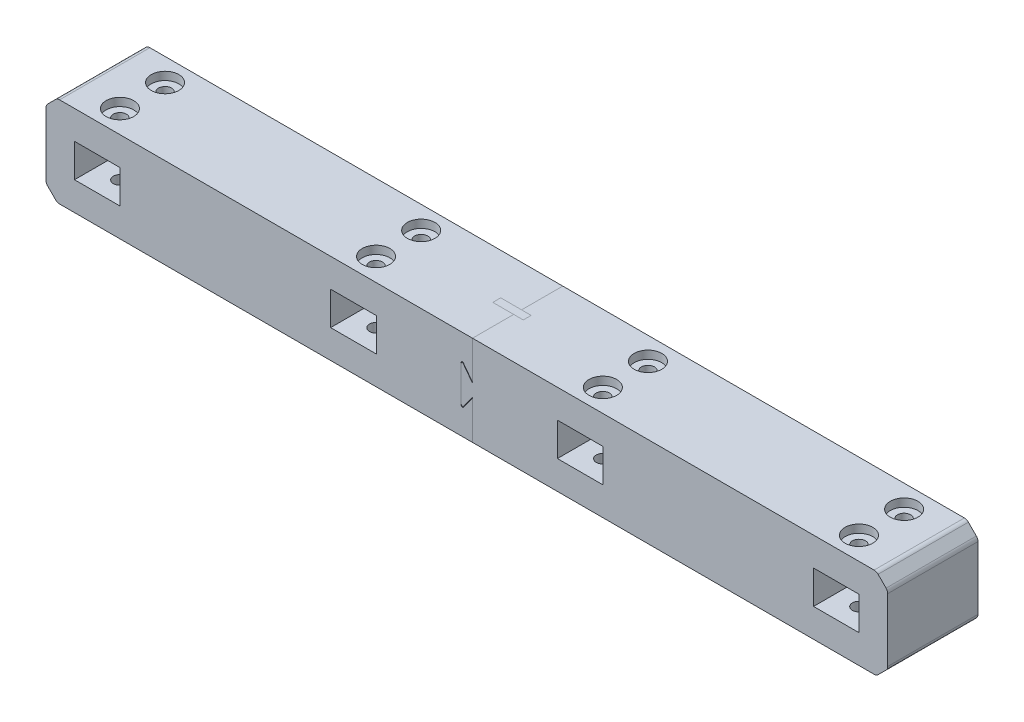
from build123d import *

# Parameters (mm, degrees)
SKETCH2_W                               = 373
SKETCH2_H                               = 40
BOSS_EXTRUDE1_DEPTH                     = 40
SKETCH3_W                               = 20.25
SKETCH3_H                               = 14.75
CUT_EXTRUDE1_DEPTH                      = 192.786991217
CHAMFER1_SIZE                           = 5
FILLET1_R                               = 2.5
CBORE_FOR_M5_HEX_HEAD_BOLT1_D           = 5.8
CBORE_FOR_M5_HEX_HEAD_BOLT1_CBORE_D     = 12.24
CBORE_FOR_M5_HEX_HEAD_BOLT1_CBORE_DEPTH = 3.58
LPATTERN1_COUNT                         = 2
LPATTERN1_PITCH                         = 113.5
MIRROR1_COPY_1_D                        = 5.8
MIRROR1_COPY_1_CBORE_D                  = 12.24
MIRROR1_COPY_1_CBORE_DEPTH              = 3.58
MIRROR2_COPY_1_D                        = 5.8
MIRROR2_COPY_1_CBORE_D                  = 12.24
MIRROR2_COPY_1_CBORE_DEPTH              = 3.58
MIRROR2_COPY_2_D                        = 5.8
MIRROR2_COPY_2_CBORE_D                  = 12.24
MIRROR2_COPY_2_CBORE_DEPTH              = 3.58
MIRROR2_COPY_3_D                        = 5.8
MIRROR2_COPY_3_CBORE_D                  = 12.24
MIRROR2_COPY_3_CBORE_DEPTH              = 3.58
SPLIT1_OUTLINE_W                        = 20.25
SPLIT1_OUTLINE_H                        = 14.75
SPLIT1_DEPTH                            = 40
SPLIT1_START                            = 18.25
SPLIT1_2_DEPTH                          = 3.5
SPLIT1_START_2                          = -20
SPLIT1_3_OUTLINE_W                      = 93.25
SPLIT1_3_OUTLINE_H                      = 40
SPLIT1_3_OUTLINE_W_2                    = 12.625
SPLIT1_3_DEPTH                          = 40
SPLIT1_4_OUTLINE_W                      = 5
SPLIT1_4_OUTLINE_H                      = 18.25
SPLIT1_4_OUTLINE_W_2                    = 20.25
SPLIT1_4_OUTLINE_H_2                    = 40
SPLIT1_4_OUTLINE_R                      = 2.9
SPLIT1_4_DEPTH                          = 12.625
SPLIT1_START_3                          = 7.375
SPLIT1_5_OUTLINE_W                      = 5
SPLIT1_5_OUTLINE_H                      = 18.25
SPLIT1_5_OUTLINE_W_2                    = 20.25
SPLIT1_5_OUTLINE_H_2                    = 40
SPLIT1_5_OUTLINE_R                      = 6.12
SPLIT1_5_DEPTH                          = 12.625
SPLIT1_6_OUTLINE_R                      = 6.12
SPLIT1_6_OUTLINE_R_2                    = 2.9
SPLIT1_6_DEPTH                          = 9.045
SPLIT1_START_4                          = -7.375
SPLIT1_7_OUTLINE_W                      = 5
SPLIT1_7_OUTLINE_H                      = 18.25
SPLIT1_7_DEPTH                          = 4.625
SPLIT1_START_5                          = 2.75
SPLIT1_8_OUTLINE_W                      = 5
SPLIT1_8_OUTLINE_H                      = 18.25
SPLIT1_8_DEPTH                          = 4.625
SPLIT1_START_6                          = -1
SPLIT1_9_DEPTH                          = 42
SPLIT1_10_DEPTH                         = 3.5
SPLIT1_11_DEPTH                         = 3.5
CUT_EXTRUDE3_DEPTH                      = 192.786991217
FILLET2_R                               = 0.5
FILLET3_R                               = 0.5


with BuildPart() as part:
    # Sketch2 → Boss-Extrude1 (new body)
    with BuildSketch(Plane.XY):
        Rectangle(SKETCH2_W, SKETCH2_H)
    extrude(amount=BOSS_EXTRUDE1_DEPTH)

    # Sketch3 → Cut-Extrude1 (cut, through all)
    with BuildSketch(Plane.XY.offset(40)):
        with Locations((-163.75, 0)):
            Rectangle(SKETCH3_W, SKETCH3_H)
        with Locations((-50.25, 0)):
            Rectangle(SKETCH3_W, SKETCH3_H)
        with Locations((50.25, 0)):
            Rectangle(SKETCH3_W, SKETCH3_H)
        with Locations((163.75, 0)):
            Rectangle(SKETCH3_W, SKETCH3_H)
    extrude(amount=-CUT_EXTRUDE1_DEPTH, mode=Mode.SUBTRACT)

    # Chamfer1
    chamfer1_edges = [part.edges().sort_by_distance(p)[0] for p in [
        (186.5, -20, 20),
        (-186.5, -20, 20),
        (-186.5, 20, 20),
        (186.5, 20, 20),
    ]]
    chamfer(chamfer1_edges, length=CHAMFER1_SIZE)

    # Fillet1
    fillet1_edges = [part.edges().sort_by_distance(p)[0] for p in [
        (-181.5, 20, 20),
        (181.5, 20, 20),
        (186.5, -15, 20),
        (186.5, 15, 20),
        (-181.5, -20, 20),
        (181.5, -20, 20),
        (-186.5, 15, 20),
        (-186.5, -15, 20),
    ]]
    fillet(fillet1_edges, radius=FILLET1_R)

    # CBORE for M5 Hex Head Bolt1 (through all)
    with Locations(Plane(origin=(0, 20, 0), x_dir=(1, 0, 0), z_dir=(0, 1, 0))):
        with Locations((-163.75, -10)):
            cbore_for_m5_hex_head_bolt1 = CounterBoreHole(CBORE_FOR_M5_HEX_HEAD_BOLT1_D / 2, CBORE_FOR_M5_HEX_HEAD_BOLT1_CBORE_D / 2, CBORE_FOR_M5_HEX_HEAD_BOLT1_CBORE_DEPTH)

    # LPattern1: CBORE for M5 Hex Head Bolt1 ×2
    with Locations(*[(i * LPATTERN1_PITCH, 0, 0) for i in range(1, LPATTERN1_COUNT)]):
        add(cbore_for_m5_hex_head_bolt1, mode=Mode.SUBTRACT)

    # Mirror1: CBORE for M5 Hex Head Bolt1 across plane
    add(cbore_for_m5_hex_head_bolt1.mirror(Plane(origin=(0, 0, 0), x_dir=(0, 0, 1), z_dir=(1, 0, 0))), mode=Mode.SUBTRACT)

    # Mirror1 copy 1 (through all)
    with Locations(Plane(origin=(-113.5, 20, 0), x_dir=(-1, 0, 0), z_dir=(0, 1, 0))):
        with Locations((-163.75, 10)):
            CounterBoreHole(MIRROR1_COPY_1_D / 2, MIRROR1_COPY_1_CBORE_D / 2, MIRROR1_COPY_1_CBORE_DEPTH)

    # Mirror2: CBORE for M5 Hex Head Bolt1 across plane
    add(cbore_for_m5_hex_head_bolt1.mirror(Plane.XY.offset(20)), mode=Mode.SUBTRACT)

    # Mirror2 copy 1 (through all)
    with Locations(Plane(origin=(113.5, 20, 40), x_dir=(1, 0, 0), z_dir=(0, 1, 0))):
        with Locations((-163.75, 10)):
            CounterBoreHole(MIRROR2_COPY_1_D / 2, MIRROR2_COPY_1_CBORE_D / 2, MIRROR2_COPY_1_CBORE_DEPTH)

    # Mirror2 copy 2 (through all)
    with Locations(Plane(origin=(0, 20, 40), x_dir=(-1, 0, 0), z_dir=(0, 1, 0))):
        with Locations((-163.75, -10)):
            CounterBoreHole(MIRROR2_COPY_2_D / 2, MIRROR2_COPY_2_CBORE_D / 2, MIRROR2_COPY_2_CBORE_DEPTH)

    # Mirror2 copy 3 (through all)
    with Locations(Plane(origin=(-113.5, 20, 40), x_dir=(-1, 0, 0), z_dir=(0, 1, 0))):
        with Locations((-163.75, -10)):
            CounterBoreHole(MIRROR2_COPY_3_D / 2, MIRROR2_COPY_3_CBORE_D / 2, MIRROR2_COPY_3_CBORE_DEPTH)

    # Split1: read off the stored shape, not the designer's step
    # Split1 outline → Split1 (cut)
    with BuildSketch(Plane.XY):
        with BuildLine():
            Line((2.5, -20), (2.5, -2.75))
            Line((2.5, -2.75), (-2.5, -9.375))
            Line((-2.5, -9.375), (-2.5, 9.375))
            Line((-2.5, 9.375), (2.5, 2.75))
            Line((2.5, 2.75), (2.5, 20))
            Line((2.5, 20), (-180.464466094, 20))
            ThreePointArc((-180.464466094, 20), (-181.421174675, 19.809698831), (-182.232233047, 19.267766953))
            Line((-182.232233047, 19.267766953), (-185.767766953, 15.732233047))
            ThreePointArc((-185.767766953, 15.732233047), (-186.309698831, 14.921174675), (-186.5, 13.964466094))
            Line((-186.5, 13.964466094), (-186.5, -13.964466094))
            ThreePointArc((-186.5, -13.964466094), (-186.309698831, -14.921174675), (-185.767766953, -15.732233047))
            Line((-185.767766953, -15.732233047), (-182.232233047, -19.267766953))
            ThreePointArc((-182.232233047, -19.267766953), (-181.421174675, -19.809698831), (-180.464466094, -20))
            Line((-180.464466094, -20), (2.5, -20))
        make_face()
        with Locations((-163.75, 0)):
            Rectangle(SPLIT1_OUTLINE_W, SPLIT1_OUTLINE_H, mode=Mode.SUBTRACT)
        with Locations((-50.25, 0)):
            Rectangle(SPLIT1_OUTLINE_W, SPLIT1_OUTLINE_H, mode=Mode.SUBTRACT)
    extrude(amount=SPLIT1_DEPTH, mode=Mode.SUBTRACT)

    # Split1 2 outline → Split1 2 (cut)
    with BuildSketch(Plane.XY.offset(SPLIT1_START)):
        Polygon((-2.5, -9.375), (2.5, -2.75), (2.5, -20), (6.75, -20), (6.75, 20), (2.5, 20), (2.5, 2.75), (-2.5, 9.375), align=None)
    extrude(amount=SPLIT1_2_DEPTH, mode=Mode.SUBTRACT)

    # Fillet2
    fillet2_edges = [part.edges().sort_by_distance(p)[0] for p in [
        (-2.5, -9.375, 9.125),
        (-2.5, -9.375, 30.875),
        (-2.5, 9.375, 9.125),
        (-2.5, 9.375, 30.875),
    ]]
    fillet(fillet2_edges, radius=FILLET2_R)


with BuildPart() as body_2:
    # Split1 3 outline → Split1 3 (new body)
    with BuildSketch(Plane(origin=(0, 0, 0), x_dir=(1, 0, 0), z_dir=(0, 1, 0)).offset(SPLIT1_START_2)):
        Polygon((-2.5, -40), (-2.5, -21.75), (-6.75, -21.75), (-6.75, -18.25), (-2.5, -18.25), (-2.5, 0), (-40.125, 0), (-40.125, -40), align=None)
        with Locations((-107, -20)):
            Rectangle(SPLIT1_3_OUTLINE_W, SPLIT1_3_OUTLINE_H)
        with Locations((-180.1875, -20)):
            Rectangle(SPLIT1_3_OUTLINE_W_2, SPLIT1_3_OUTLINE_H)
    extrude(amount=SPLIT1_3_DEPTH)

    # Split1 4 outline → Split1 4 (add)
    # profile 1 of 4: a face of its own
    with BuildSketch(Plane(origin=(0, 0, 0), x_dir=(1, 0, 0), z_dir=(0, 1, 0)).offset(SPLIT1_START_2)):
        with Locations((0, -30.875)):
            Rectangle(SPLIT1_4_OUTLINE_W, SPLIT1_4_OUTLINE_H)
    # profile 2 of 4: a face of its own
    with BuildSketch(Plane(origin=(0, 0, 0), x_dir=(1, 0, 0), z_dir=(0, 1, 0)).offset(SPLIT1_START_2)):
        with Locations((-50.25, -20)):
            Rectangle(SPLIT1_4_OUTLINE_W_2, SPLIT1_4_OUTLINE_H_2)
        with Locations((-50.25, -30)):
            Circle(SPLIT1_4_OUTLINE_R, mode=Mode.SUBTRACT)
        with Locations((-50.25, -10)):
            Circle(SPLIT1_4_OUTLINE_R, mode=Mode.SUBTRACT)
    # profile 3 of 4: a face of its own
    with BuildSketch(Plane(origin=(0, 0, 0), x_dir=(1, 0, 0), z_dir=(0, 1, 0)).offset(SPLIT1_START_2)):
        with Locations((0, -9.125)):
            Rectangle(SPLIT1_4_OUTLINE_W, SPLIT1_4_OUTLINE_H)
    # profile 4 of 4: a face of its own
    with BuildSketch(Plane(origin=(0, 0, 0), x_dir=(1, 0, 0), z_dir=(0, 1, 0)).offset(SPLIT1_START_2)):
        with Locations((-163.75, -20)):
            Rectangle(SPLIT1_4_OUTLINE_W_2, SPLIT1_4_OUTLINE_H_2)
        with Locations((-163.75, -30)):
            Circle(SPLIT1_4_OUTLINE_R, mode=Mode.SUBTRACT)
        with Locations((-163.75, -10)):
            Circle(SPLIT1_4_OUTLINE_R, mode=Mode.SUBTRACT)
    extrude(amount=SPLIT1_4_DEPTH)

    # Split1 5 outline → Split1 5 (add)
    # profile 1 of 4: a face of its own
    with BuildSketch(Plane(origin=(0, 0, 0), x_dir=(1, 0, 0), z_dir=(0, 1, 0)).offset(SPLIT1_START_3)):
        with Locations((0, -30.875)):
            Rectangle(SPLIT1_5_OUTLINE_W, SPLIT1_5_OUTLINE_H)
    # profile 2 of 4: a face of its own
    with BuildSketch(Plane(origin=(0, 0, 0), x_dir=(1, 0, 0), z_dir=(0, 1, 0)).offset(SPLIT1_START_3)):
        with Locations((-50.25, -20)):
            Rectangle(SPLIT1_5_OUTLINE_W_2, SPLIT1_5_OUTLINE_H_2)
        with Locations((-50.25, -30)):
            Circle(SPLIT1_5_OUTLINE_R, mode=Mode.SUBTRACT)
        with Locations((-50.25, -10)):
            Circle(SPLIT1_5_OUTLINE_R, mode=Mode.SUBTRACT)
    # profile 3 of 4: a face of its own
    with BuildSketch(Plane(origin=(0, 0, 0), x_dir=(1, 0, 0), z_dir=(0, 1, 0)).offset(SPLIT1_START_3)):
        with Locations((0, -9.125)):
            Rectangle(SPLIT1_5_OUTLINE_W, SPLIT1_5_OUTLINE_H)
    # profile 4 of 4: a face of its own
    with BuildSketch(Plane(origin=(0, 0, 0), x_dir=(1, 0, 0), z_dir=(0, 1, 0)).offset(SPLIT1_START_3)):
        with Locations((-163.75, -20)):
            Rectangle(SPLIT1_5_OUTLINE_W_2, SPLIT1_5_OUTLINE_H_2)
        with Locations((-163.75, -30)):
            Circle(SPLIT1_5_OUTLINE_R, mode=Mode.SUBTRACT)
        with Locations((-163.75, -10)):
            Circle(SPLIT1_5_OUTLINE_R, mode=Mode.SUBTRACT)
    extrude(amount=SPLIT1_5_DEPTH)

    # Split1 6 outline → Split1 6 (add)
    # profile 1 of 4: a face of its own
    with BuildSketch(Plane(origin=(0, 0, 0), x_dir=(1, 0, 0), z_dir=(0, 1, 0)).offset(SPLIT1_START_3)):
        with Locations((-163.75, -10)):
            Circle(SPLIT1_6_OUTLINE_R)
        with Locations((-163.75, -10)):
            Circle(SPLIT1_6_OUTLINE_R_2, mode=Mode.SUBTRACT)
    # profile 2 of 4: a face of its own
    with BuildSketch(Plane(origin=(0, 0, 0), x_dir=(1, 0, 0), z_dir=(0, 1, 0)).offset(SPLIT1_START_3)):
        with Locations((-50.25, -10)):
            Circle(SPLIT1_6_OUTLINE_R)
        with Locations((-50.25, -10)):
            Circle(SPLIT1_6_OUTLINE_R_2, mode=Mode.SUBTRACT)
    # profile 3 of 4: a face of its own
    with BuildSketch(Plane(origin=(0, 0, 0), x_dir=(1, 0, 0), z_dir=(0, 1, 0)).offset(SPLIT1_START_3)):
        with Locations((-163.75, -30)):
            Circle(SPLIT1_6_OUTLINE_R)
        with Locations((-163.75, -30)):
            Circle(SPLIT1_6_OUTLINE_R_2, mode=Mode.SUBTRACT)
    # profile 4 of 4: a face of its own
    with BuildSketch(Plane(origin=(0, 0, 0), x_dir=(1, 0, 0), z_dir=(0, 1, 0)).offset(SPLIT1_START_3)):
        with Locations((-50.25, -30)):
            Circle(SPLIT1_6_OUTLINE_R)
        with Locations((-50.25, -30)):
            Circle(SPLIT1_6_OUTLINE_R_2, mode=Mode.SUBTRACT)
    extrude(amount=SPLIT1_6_DEPTH)

    # Split1 7 outline → Split1 7 (add)
    with BuildSketch(Plane(origin=(0, 0, 0), x_dir=(1, 0, 0), z_dir=(0, 1, 0)).offset(SPLIT1_START_4)):
        with Locations((0, -30.875)):
            Rectangle(SPLIT1_7_OUTLINE_W, SPLIT1_7_OUTLINE_H)
        with Locations((0, -9.125)):
            Rectangle(SPLIT1_7_OUTLINE_W, SPLIT1_7_OUTLINE_H)
    extrude(amount=SPLIT1_7_DEPTH)

    # Split1 8 outline → Split1 8 (add)
    with BuildSketch(Plane(origin=(0, 0, 0), x_dir=(1, 0, 0), z_dir=(0, 1, 0)).offset(SPLIT1_START_5)):
        with Locations((0, -30.875)):
            Rectangle(SPLIT1_8_OUTLINE_W, SPLIT1_8_OUTLINE_H)
        with Locations((0, -9.125)):
            Rectangle(SPLIT1_8_OUTLINE_W, SPLIT1_8_OUTLINE_H)
    extrude(amount=SPLIT1_8_DEPTH)

    # Split1 9 outline → Split1 9 (cut)
    with BuildSketch(Plane.XY.offset(SPLIT1_START_6)):
        Polygon((-2.5, -2.75), (-2.5, -9.375), (2.5, -2.75), align=None)
        Polygon((-2.5, 9.375), (-2.5, 2.75), (2.5, 2.75), align=None)
        with BuildLine():
            ThreePointArc((-185.767766953, -15.732233047), (-186.309698831, -14.921174675), (-186.5, -13.964466094))
            Line((-186.5, -13.964466094), (-186.5, -20))
            Line((-186.5, -20), (-180.464466094, -20))
            ThreePointArc((-180.464466094, -20), (-181.421174675, -19.809698831), (-182.232233047, -19.267766953))
            Line((-182.232233047, -19.267766953), (-185.767766953, -15.732233047))
        make_face()
        with BuildLine():
            ThreePointArc((-182.232233047, 19.267766953), (-181.421174675, 19.809698831), (-180.464466094, 20))
            Line((-180.464466094, 20), (-186.5, 20))
            Line((-186.5, 20), (-186.5, 13.964466094))
            ThreePointArc((-186.5, 13.964466094), (-186.309698831, 14.921174675), (-185.767766953, 15.732233047))
            Line((-185.767766953, 15.732233047), (-182.232233047, 19.267766953))
        make_face()
    extrude(amount=SPLIT1_9_DEPTH, mode=Mode.SUBTRACT)

    # Sketch9 → Cut-Extrude3 (cut, through all)
    with BuildSketch(Plane.XY.offset(40)):
        Polygon((-2.5, 9.75), (-2.5, -9.75), (2.5, -3.125), (2.5, 3.125), align=None)
    extrude(amount=-CUT_EXTRUDE3_DEPTH, mode=Mode.SUBTRACT)

    # Fillet3
    fillet3_edges = [body_2.edges().sort_by_distance(p)[0] for p in [
        (-2.5, 9.75, 9.125),
        (-2.5, 9.75, 30.875),
        (-2.5, -9.75, 30.875),
        (-2.5, -9.75, 9.125),
    ]]
    fillet(fillet3_edges, radius=FILLET3_R)


with BuildPart() as body_3:
    # Split1 10 outline → Split1 10 (new body)
    with BuildSketch(Plane.XY.offset(SPLIT1_START)):
        Polygon((2.5, -20), (2.5, -2.75), (-2.5, -9.375), (-2.5, 9.375), (2.5, 2.75), (2.5, 20), (-6.75, 20), (-6.75, -20), align=None)
    extrude(amount=SPLIT1_10_DEPTH)


with BuildPart() as body_4:
    # Split1 11 outline → Split1 11 (new body)
    with BuildSketch(Plane.XY.offset(SPLIT1_START)):
        Polygon((6.75, -20), (6.75, 20), (2.5, 20), (2.5, 2.75), (-2.5, 9.375), (-2.5, -9.375), (2.5, -2.75), (2.5, -20), align=None)
    extrude(amount=SPLIT1_11_DEPTH)


with BuildPart() as body_3_1:
    add(body_3.part)

    # Combine1: read off the stored shape, not the designer's step
    # Combine1: union body 4
    add(body_4.part)


solid = Compound([part.part, body_2.part, body_3_1.part])
